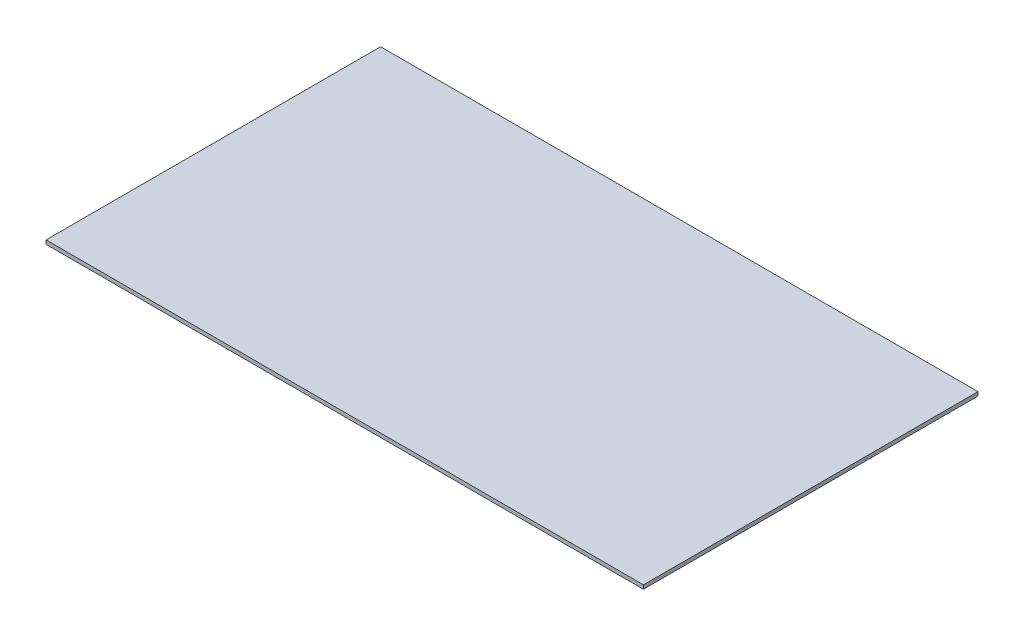
from build123d import *

# Parameters (mm, degrees)
ESQUISSE1_W        = 2500
ESQUISSE1_H        = 1400
BOSS_EXTRU_1_DEPTH = 16


with BuildPart() as part:
    # Esquisse1 → Boss.-Extru.1 (new body)
    with BuildSketch(Plane(origin=(0, 0, 0), x_dir=(1, 0, 0), z_dir=(0, 1, 0))):
        with Locations((1250, 700)):
            Rectangle(ESQUISSE1_W, ESQUISSE1_H)
    extrude(amount=BOSS_EXTRU_1_DEPTH)


solid = part.part
